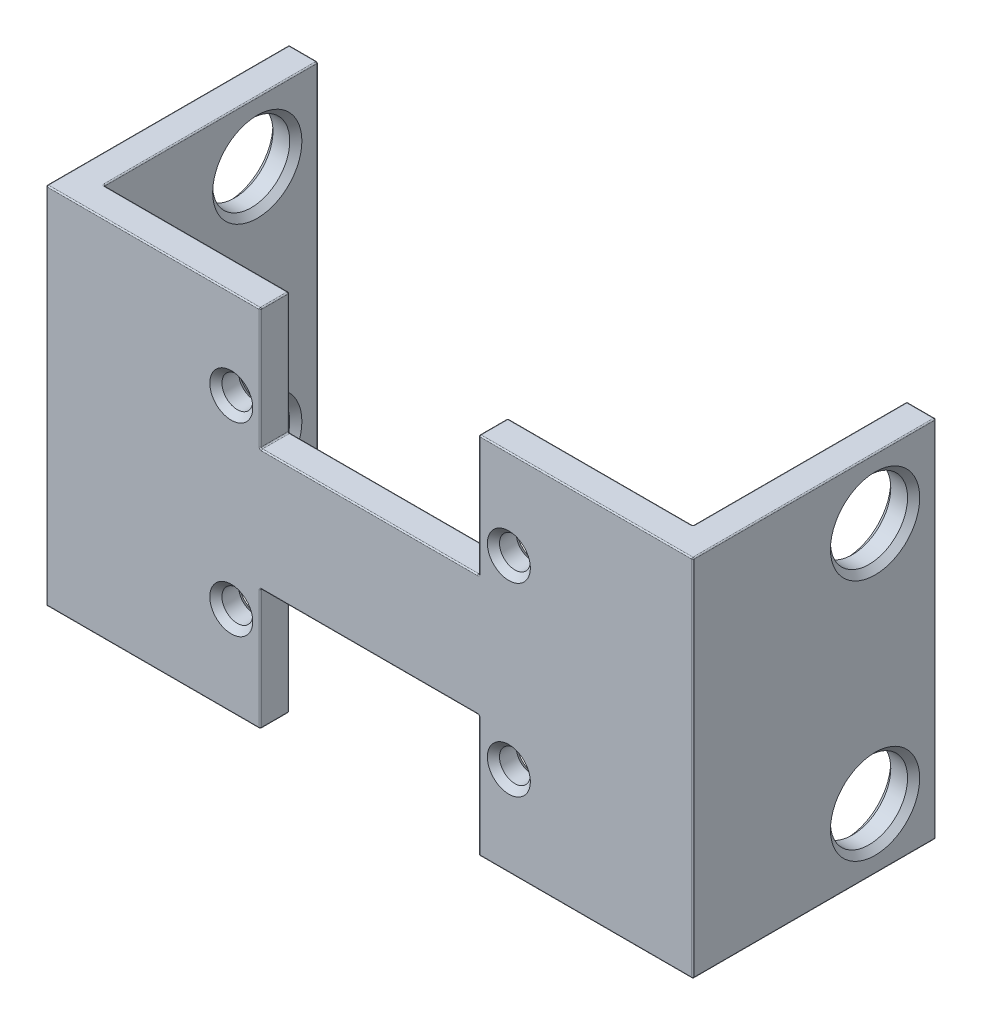
from build123d import *

# Parameters (mm, degrees)
BOSS_EXTRUDE1_DEPTH = 30
SKETCH2_R           = 1.27
CUT_EXTRUDE1_DEPTH  = 63.361058374
SKETCH3_R           = 3.175
CUT_EXTRUDE2_DEPTH  = 64.618505624
FILLET1_R           = 0.1
CHAMFER1_SIZE       = 0.5
SKETCH4_W           = 18
SKETCH4_H           = 10
CUT_EXTRUDE4_DEPTH  = 10
FILLET2_R           = 0.1


with BuildPart() as part:
    # Sketch1 → Boss-Extrude1 (new body)
    with BuildSketch(Plane(origin=(0, 0, 0), x_dir=(1, 0, 0), z_dir=(0, 1, 0))):
        Polygon((0, 0), (0, 17.61875), (2.38125, 17.61875), (2.38125, -2.38125), (-50.88125, -2.38125), (-50.88125, 17.61875), (-48.5, 17.61875), (-48.5, 0), align=None)
    extrude(amount=BOSS_EXTRUDE1_DEPTH)

    # Sketch2 → Cut-Extrude1 (cut, through all)
    with BuildSketch(Plane.XY.offset(2.38125)):
        with Locations((-35.64, 7.38)):
            Circle(SKETCH2_R)
        with Locations((-12.78, 7.38)):
            Circle(SKETCH2_R)
        with Locations((-12.78, 22.62)):
            Circle(SKETCH2_R)
        with Locations((-35.64, 22.62)):
            Circle(SKETCH2_R)
    extrude(amount=-CUT_EXTRUDE1_DEPTH, mode=Mode.SUBTRACT)

    # Sketch3 → Cut-Extrude2 (cut, through all)
    with BuildSketch(Plane(origin=(2.38125, 0, 0), x_dir=(0, 0, -1), z_dir=(1, 0, 0))):
        with Locations((12.61875, 25)):
            Circle(SKETCH3_R)
        with Locations((12.61875, 5)):
            Circle(SKETCH3_R)
    extrude(amount=-CUT_EXTRUDE2_DEPTH, mode=Mode.SUBTRACT)

    # Fillet1
    fillet1_edges = [part.edges().sort_by_distance(p)[0] for p in [
        (-48.5, 15, -17.61875),
        (-50.88125, 15, -17.61875),
        (2.38125, 15, -17.61875),
        (0, 15, -17.61875),
        (-48.5, 0, -8.809375),
        (-49.690625, 0, -17.61875),
        (-50.88125, 0, -7.61875),
        (-24.25, 0, 2.38125),
        (2.38125, 0, -7.61875),
        (1.190625, 0, -17.61875),
        (0, 0, -8.809375),
        (-24.25, 0, 0),
        (0, 30, -8.809375),
        (1.190625, 30, -17.61875),
        (2.38125, 30, -7.61875),
        (-24.25, 30, 2.38125),
        (-50.88125, 30, -7.61875),
        (-49.690625, 30, -17.61875),
        (-48.5, 30, -8.809375),
        (-24.25, 30, 0),
        (-50.88125, 15, 2.38125),
        (2.38125, 15, 2.38125),
        (0, 15, 0),
        (-48.5, 15, 0),
    ]]
    fillet(fillet1_edges, radius=FILLET1_R)

    # Chamfer1
    chamfer1_edges = [part.edges().sort_by_distance(p)[0] for p in [
        (0, 5, -9.44375),
        (2.38125, 5, -9.44375),
        (0, 25, -9.44375),
        (2.38125, 25, -9.44375),
        (-48.5, 25, -9.44375),
        (-50.88125, 25, -9.44375),
        (-48.5, 5, -9.44375),
        (-50.88125, 5, -9.44375),
        (-14.05, 7.38, 0),
        (-14.05, 7.38, 2.38125),
        (-14.05, 22.62, 0),
        (-14.05, 22.62, 2.38125),
        (-36.91, 7.38, 0),
        (-36.91, 7.38, 2.38125),
        (-36.91, 22.62, 0),
        (-36.91, 22.62, 2.38125),
    ]]
    chamfer(chamfer1_edges, length=CHAMFER1_SIZE)

    # Sketch4 → Cut-Extrude4 (cut)
    with BuildSketch(Plane.XY.offset(2.38125)):
        with Locations((-24.25, 25)):
            Rectangle(SKETCH4_W, SKETCH4_H)
        with Locations((-24.25, 5)):
            Rectangle(SKETCH4_W, SKETCH4_H)
    extrude(amount=-CUT_EXTRUDE4_DEPTH, mode=Mode.SUBTRACT)

    # Fillet2
    fillet2_edges = [part.edges().sort_by_distance(p)[0] for p in [
        (-15.25, 0, 1.190625),
        (-15.25, 0.029289322, 0.029289322),
        (-15.25, 5.05, 0),
        (-15.25, 5.05, 2.38125),
        (-15.25, 0.029289322, 2.351960678),
        (-33.25, 5.05, 2.38125),
        (-33.25, 5.05, 0),
        (-33.25, 0.029289322, 0.029289322),
        (-33.25, 0, 1.190625),
        (-33.25, 0.029289322, 2.351960678),
        (-24.25, 10, 0),
        (-33.25, 10, 1.190625),
        (-24.25, 10, 2.38125),
        (-15.25, 10, 1.190625),
        (-15.25, 24.95, 2.38125),
        (-15.25, 24.95, 0),
        (-15.25, 29.970710678, 0.029289322),
        (-15.25, 30, 1.190625),
        (-15.25, 29.970710678, 2.351960678),
        (-24.25, 20, 0),
        (-15.25, 20, 1.190625),
        (-24.25, 20, 2.38125),
        (-33.25, 30, 1.190625),
        (-33.25, 29.970710678, 0.029289322),
        (-33.25, 24.95, 0),
        (-33.25, 20, 1.190625),
        (-33.25, 24.95, 2.38125),
        (-33.25, 29.970710678, 2.351960678),
    ]]
    fillet(fillet2_edges, radius=FILLET2_R)


solid = part.part
